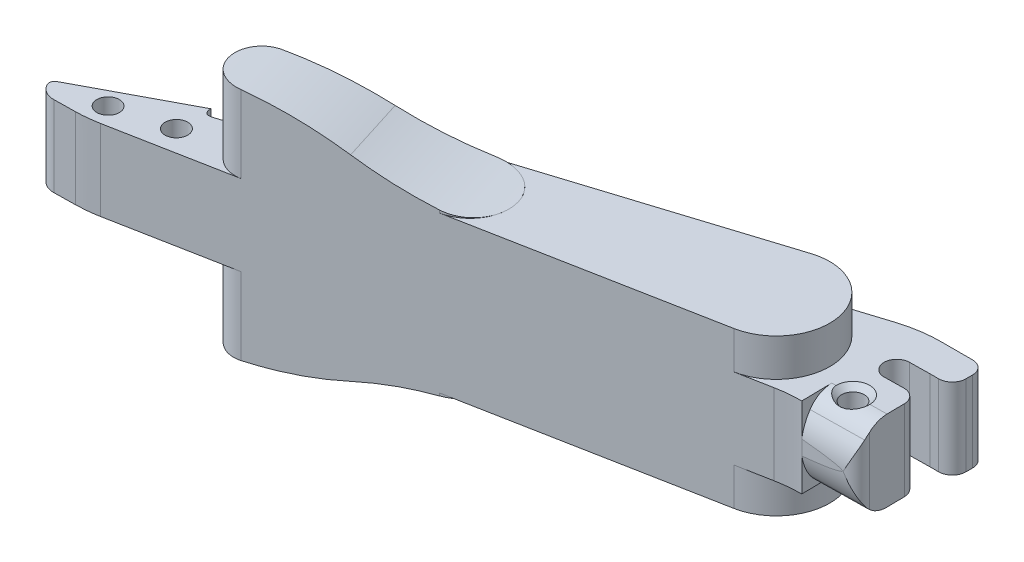
from build123d import *
from build123d.topology import SkipClean

# Parameters (mm, degrees)
SKETCH1_R                = 1.0668
BOSS_EXTRUDE1_DEPTH      = 7.62
FILLET1_R                = 0.635
FILLET2_R                = 0.254
FILLET3_R                = 12.7
FILLET4_R                = 6.35
FILLET5_R                = 6.35
FILLET6_R                = 12.7
FILLET7_R                = 1.27
CHAMFER1_SIZE            = 0.508
BOSS_EXTRUDE2_DEPTH      = 7.62
SKETCH3_R                = 1.0668
CUT_EXTRUDE1_DEPTH       = 54.69653448
BOSS_EXTRUDE3_DEPTH      = 7.62
CUT_EXTRUDE2_DEPTH       = 54.69653448
CUT_EXTRUDE3_DEPTH       = 54.696534623
CUT_EXTRUDE3_DEPTH_BACK  = 54.696534623
CUT_EXTRUDE4_DEPTH       = 54.696534623
CUT_EXTRUDE5_DEPTH       = 54.696534623
CUT_EXTRUDE7_DEPTH       = 5.149124
CUT_EXTRUDE8_DEPTH       = 54.696534623
SKETCH13_R               = 1.0668
BOSS_EXTRUDE4_DEPTH      = 7.62
SKETCH14_R               = 1.0668
CUT_EXTRUDE10_DEPTH      = 54.696534623
CUT_EXTRUDE11_DEPTH      = 54.696534623
BOSS_EXTRUDE5_DEPTH      = 7.62
BOSS_EXTRUDE6_DEPTH      = 3.556
BOSS_EXTRUDE7_START      = 3.556
BOSS_EXTRUDE7_DEPTH      = 3.556
BOSS_EXTRUDE8_START      = -14.732
BOSS_EXTRUDE8_DEPTH      = 14.732
BOSS_EXTRUDE9_START      = 3.81
BOSS_EXTRUDE9_DEPTH      = 3.81
BOSS_EXTRUDE10_DEPTH     = 3.81
CUT_EXTRUDE14_DEPTH      = 53.444849107
CUT_EXTRUDE14_DEPTH_BACK = 53.444849107
CUT_EXTRUDE15_DEPTH      = 53.612958424
CUT_EXTRUDE15_DEPTH_BACK = 53.612958424


with BuildPart() as part:
    # Sketch1 → Boss-Extrude1 (new body)
    with BuildSketch(Plane(origin=(0, 0, 0), x_dir=(1, 0, 0), z_dir=(0, 1, 0))):
        with BuildLine():
            ThreePointArc((-2.312651627, -3.977825944), (-2.983997225, -5.519250699), (-1.53747622, -6.376147525))
            Line((-1.53747622, -6.376147525), (13.957313837, -3.419054878))
            Line((13.957313837, -3.419054878), (20.308092604, -3.419054878))
            Line((20.308092604, -3.419054878), (20.397600553, -9.134054878))
            Line((20.397600553, -9.134054878), (14.046821786, -9.134054878))
            Line((14.046821786, -9.134054878), (-41.672552026, -19.767780795))
            Line((-41.672552026, -19.767780795), (-49.292552026, -19.887124727))
            Line((-49.292552026, -19.887124727), (13.758431673, 9.279387778))
            Line((13.758431673, 9.279387778), (20.109210441, 9.279387778))
            Line((20.109210441, 9.279387778), (20.197160951, 3.663828859))
            Line((20.197160951, 3.663828859), (13.847939623, 3.564387778))
            Line((13.847939623, 3.564387778), (-2.312651627, -3.977825944))
        make_face()
        with Locations(Location((16.977796312, 6.471608319, 0), (0, 0, 90))):
            Circle(SKETCH1_R, mode=Mode.SUBTRACT)
        with Locations(Location((17.176678475, -6.226834337, 0), (0, 0, 90))):
            Circle(SKETCH1_R, mode=Mode.SUBTRACT)
        with BuildLine():
            Line((-24.483085862, -12.608506291), (-6.807562993, -4.432054021))
            ThreePointArc((-6.807562993, -4.432054021), (-6.543189182, -6.882524401), (-5.156537158, -8.920144277))
            Line((-5.156537158, -8.920144277), (-24.483085862, -12.608506291))
        make_face(mode=Mode.SUBTRACT)
    extrude(amount=BOSS_EXTRUDE1_DEPTH)

    # Fillet1
    fillet1_edges = [part.edges().sort_by_distance(p)[0] for p in [
        (-5.156537158, 3.81, 8.920144277),
        (-6.807562993, 3.81, 4.432054021),
    ]]
    fillet(fillet1_edges, radius=FILLET1_R)

    # Fillet2
    fillet2_edges = [part.edges().sort_by_distance(p)[0] for p in [
        (-24.483085862, 3.81, 12.608506291),
    ]]
    fillet(fillet2_edges, radius=FILLET2_R)

    # Fillet3
    fillet3_edges = [part.edges().sort_by_distance(p)[0] for p in [
        (13.957313837, 3.81, 3.419054878),
    ]]
    fillet(fillet3_edges, radius=FILLET3_R)

    # Fillet4
    fillet4_edges = [part.edges().sort_by_distance(p)[0] for p in [
        (13.758431673, 3.81, -9.279387778),
    ]]
    fillet(fillet4_edges, radius=FILLET4_R)

    # Fillet5
    fillet5_edges = [part.edges().sort_by_distance(p)[0] for p in [
        (13.847939623, 3.81, -3.564387778),
    ]]
    fillet(fillet5_edges, radius=FILLET5_R)

    # Fillet6
    fillet6_edges = [part.edges().sort_by_distance(p)[0] for p in [
        (14.046821786, 3.81, 9.134054878),
    ]]
    fillet(fillet6_edges, radius=FILLET6_R)

    # Fillet7
    fillet7_edges = [part.edges().sort_by_distance(p)[0] for p in [
        (20.308092604, 3.81, 3.419054878),
        (20.397600553, 3.81, 9.134054878),
        (20.109210441, 3.81, -9.279387778),
        (20.197160951, 3.81, -3.663828859),
    ]]
    fillet(fillet7_edges, radius=FILLET7_R)

    # Chamfer1
    chamfer1_edges = [part.edges().sort_by_distance(p)[0] for p in [
        (17.176678475, 7.62, 7.293634337),
        (17.176678475, 0, 7.293634337),
        (16.977796312, 0, -5.404808319),
        (16.977796312, 7.62, -5.404808319),
    ]]
    chamfer(chamfer1_edges, length=CHAMFER1_SIZE)

    # Sketch2 → Boss-Extrude2 (add)
    with BuildSketch(Plane(origin=(0, 7.62, 0), x_dir=(1, 0, 0), z_dir=(0, 1, 0))):
        Polygon((-49.292552026, -19.887124727), (-36.592552026, -12.132680481), (-36.592552026, -14.012280481), align=None)
    extrude(amount=-BOSS_EXTRUDE2_DEPTH)

    # Sketch3 → Cut-Extrude1 (cut, through all)
    with BuildSketch(Plane(origin=(0, 7.62, 0), x_dir=(1, 0, 0), z_dir=(0, 1, 0))):
        with Locations(Location((-36.592552026, -16.405286069, 0), (0, 0, 270))):
            Circle(SKETCH3_R)
        with Locations(Location((-41.672552026, -17.501119487, 0), (0, 0, 270))):
            Circle(SKETCH3_R)
    extrude(amount=-CUT_EXTRUDE1_DEPTH, mode=Mode.SUBTRACT)

    # Sketch4 → Boss-Extrude3 (add)
    with BuildSketch(Plane(origin=(0, 7.62, 0), x_dir=(1, 0, 0), z_dir=(0, 1, 0))):
        Polygon((-36.592552026, -14.012280481), (15.068829325, 2.295945122), (20.218584655, 2.295945122), (20.327671772, -4.669166662), (15.164053413, -3.784025035), (-17.814325189, -14.012280481), align=None)
    extrude(amount=-BOSS_EXTRUDE3_DEPTH)

    # Sketch5 → Cut-Extrude2 (cut, through all)
    with BuildSketch(Plane(origin=(0, 7.62, 0), x_dir=(1, 0, 0), z_dir=(0, 1, 0))):
        with BuildLine():
            Line((-36.592552026, -14.012280481), (2.897388899, -1.546278822))
            Line((2.897388899, -1.546278822), (12.618479777, 2.990593863))
            ThreePointArc((12.618479777, 2.990593863), (13.880078999, 3.424709468), (15.204538139, 3.585634734))
            Line((15.204538139, 3.585634734), (18.927316685, 3.643940643))
            ThreePointArc((18.927316685, 3.643940643), (19.819407053, 4.02993251), (20.177272734, 4.933673125))
            Line((20.177272734, 4.933673125), (20.128789608, 8.029275994))
            ThreePointArc((20.128789608, 8.029275994), (19.749911662, 8.914417621), (18.858945343, 9.279387778))
            Line((18.858945343, 9.279387778), (15.155999337, 9.279387778))
            ThreePointArc((15.155999337, 9.279387778), (13.791098221, 9.130963783), (12.490003113, 8.692630279))
            Line((12.490003113, 8.692630279), (-36.592552026, -14.012280481))
        make_face()
    extrude(amount=-CUT_EXTRUDE2_DEPTH, mode=Mode.SUBTRACT)

    # Fillet8
    # a fillet whose section is not a circle: 12.7 mm, written as the material it takes off along each edge
    with BuildSketch(Plane(origin=(15.068829325, 12.512358386, -2.295945122), x_dir=(1, 0, 0), z_dir=(0, -1, 0))) as fillet8_piece_1:
        with BuildLine():
            Bezier((1.956943354, 0), (0, 0), (-1.866168396, 0.589103396), weights=[1, 1, 1])
            Line((-1.866168396, 0.589103396), (0, 0))
            Line((0, 0), (1.956943354, 0))
        make_face()
    extrude(amount=17.404716772, mode=Mode.SUBTRACT)

    # Sketch6 → Cut-Extrude3 (cut, two sides: drawn at the far end of the back side and taken through both)
    with BuildSketch(Plane(origin=(0, 7.62, 0), x_dir=(1, 0, 0), z_dir=(0, 1, 0)).offset(-CUT_EXTRUDE3_DEPTH_BACK)):
        with BuildLine():
            Line((20.218584655, 2.295945122), (19.018407407, 2.295945122))
            ThreePointArc((19.018407407, 2.295945122), (19.873375685, 1.917898502), (20.237987132, 1.05711485))
            Line((20.237987132, 1.05711485), (20.218584655, 2.295945122))
        make_face()
    extrude(amount=CUT_EXTRUDE3_DEPTH + CUT_EXTRUDE3_DEPTH_BACK, mode=Mode.SUBTRACT)

    # Sketch7 → Cut-Extrude4 (cut, through all)
    with BuildSketch(Plane(origin=(0, 7.62, 0), x_dir=(1, 0, 0), z_dir=(0, 1, 0))):
        with BuildLine():
            Line((20.24793246, 0.42211485), (20.325179868, -4.510060931))
            ThreePointArc((20.325179868, -4.510060931), (19.932019888, -3.61107774), (19.015564048, -3.260572047))
            Line((19.015564048, -3.260572047), (17.110564048, -3.29040803))
            ThreePointArc((17.110564048, -3.29040803), (15.977629833, -2.062137634), (17.162746342, -0.884136377))
            Line((17.162746342, -0.884136377), (19.067746342, -0.854300394))
            ThreePointArc((19.067746342, -0.854300394), (19.910456304, -0.449664851), (20.24793246, 0.42211485))
        make_face()
    extrude(amount=-CUT_EXTRUDE4_DEPTH, mode=Mode.SUBTRACT)

    # Fillet9
    # a fillet whose section is not a circle: 0.635 mm, written as the material it adds along each edge
    with BuildSketch(Plane(origin=(-36.592552026, 7.62, 14.012280481), x_dir=(0.9536139058078862, 0, -0.30103242126028223), z_dir=(0, -1, 0))) as fillet9_piece_1:
        with BuildLine():
            Bezier((0.8663418, 0), (0, 0), (0.26079697, -0.826155588), weights=[1, 1, 1])
            Line((0.26079697, -0.826155588), (0, 0))
            Line((0, 0), (0.8663418, 0))
        make_face()
    extrude(amount=7.62)

    # Fillet10
    # a fillet whose section is not a circle: 12.7 mm, written as the material it takes off along each edge
    with BuildSketch(Plane(origin=(-41.672552026, -2.751902811, 19.767780795), x_dir=(-0.9998773744802418, 0, 0.01566001285115453), z_dir=(0, 1, 0))) as fillet10_piece_1:
        with BuildLine():
            Bezier((1.100761124, 0), (0, 0), (-1.084345727, -0.189392179), weights=[1, 1, 1])
            Line((-1.084345727, -0.189392179), (0, 0))
            Line((0, 0), (1.100761124, 0))
        make_face()
    extrude(amount=13.123805621, mode=Mode.SUBTRACT)

    # Sketch9 → Cut-Extrude5 (cut, through all)
    with BuildSketch(Plane(origin=(0, 7.62, 0), x_dir=(1, 0, 0), z_dir=(0, 1, 0))):
        with BuildLine():
            Line((-29.571777095, -13.977835129), (-15.244312484, -9.455007456))
            ThreePointArc((-15.244312484, -9.455007456), (-13.316095328, -10.530846836), (-14.50301541, -12.392747073))
            Line((-14.50301541, -12.392747073), (-29.261015781, -15.209227595))
            ThreePointArc((-29.261015781, -15.209227595), (-29.997046992, -14.740067689), (-29.571777095, -13.977835129))
        make_face()
        with BuildLine():
            Line((-5.388668297, -10.167027605), (9.807798425, -7.266868272))
            ThreePointArc((9.807798425, -7.266868272), (11.761477374, -4.202167157), (8.587618135, -2.431327837))
            Line((8.587618135, -2.431327837), (-6.165571582, -7.08854644))
            ThreePointArc((-6.165571582, -7.08854644), (-7.228746323, -8.99412784), (-5.388668297, -10.167027605))
        make_face()
    extrude(amount=-CUT_EXTRUDE5_DEPTH, mode=Mode.SUBTRACT)

    # Sketch10 → Cut-Extrude7 (cut)
    with BuildSketch(Plane(origin=(20.249576451, 0, -0.317147518), x_dir=(-0.01566001285114326, 0, -0.999877374480242), z_dir=(0.999877374480242, 0, -0.01566001285114326))):
        with BuildLine():
            Line((-9.432159353, 7.62), (-6.494979907, 7.62))
            ThreePointArc((-6.494979907, 7.62), (-7.6748352, 7.326256661), (-8.5792363, 6.513605253))
            ThreePointArc((-8.5792363, 6.513605253), (-9.202551479, 5.22389865), (-9.43223722, 3.81))
            ThreePointArc((-9.43223722, 3.81), (-9.202551479, 2.39610135), (-8.5792363, 1.106394747))
            ThreePointArc((-8.5792363, 1.106394747), (-7.6748352, 0.293743339), (-6.494979907, 0))
            Line((-6.494979907, 0), (-11.972159353, 0))
            Line((-11.972159353, 0), (-11.972159353, 7.62))
            Line((-11.972159353, 7.62), (-9.432159353, 7.62))
        make_face()
    extrude(amount=-CUT_EXTRUDE7_DEPTH, mode=Mode.SUBTRACT)

    # Sketch11 → Cut-Extrude8 (cut, through all)
    with BuildSketch(Plane(origin=(0, 7.62, 0), x_dir=(1, 0, 0), z_dir=(0, 1, 0))):
        Polygon((-36.592552026, -13.145938681), (-36.592552026, -12.132680481), (-49.292552026, -19.887124727), align=None)
    extrude(amount=-CUT_EXTRUDE8_DEPTH, mode=Mode.SUBTRACT)

    # Sketch13 → Boss-Extrude4 (add)
    with BuildSketch(Plane(origin=(0, 7.62, 0), x_dir=(1, 0, 0), z_dir=(0, 1, 0))):
        with Locations((-41.672552026, -17.501119487)):
            Circle(SKETCH13_R)
    extrude(amount=-BOSS_EXTRUDE4_DEPTH)

    # Sketch14 → Cut-Extrude10 (cut, through all)
    with BuildSketch(Plane(origin=(0, 7.62, 0), x_dir=(1, 0, 0), z_dir=(0, 1, 0))):
        with Locations(Location((-41.674974434, -17.781457961, 0), (0, 0, 270))):
            Circle(SKETCH14_R)
    extrude(amount=-CUT_EXTRUDE10_DEPTH, mode=Mode.SUBTRACT)

    # Sketch17 → Cut-Extrude11 (cut, through all)
    with BuildSketch(Plane(origin=(0, 7.62, 0), x_dir=(1, 0, 0), z_dir=(0, 1, 0))):
        with BuildLine():
            Line((-49.409275542, -19.888952843), (-44.771803837, -19.81632107))
            ThreePointArc((-44.771803837, -19.81632107), (-46.481112693, -18.436952916), (-45.432973627, -16.506720348))
            Line((-45.432973627, -16.506720348), (-54.118552026, -19.962709218))
            Line((-54.118552026, -19.962709218), (-49.409275542, -19.888952843))
        make_face()
    extrude(amount=-CUT_EXTRUDE11_DEPTH, mode=Mode.SUBTRACT)

    # Fillet11
    # a fillet whose section is not a circle: 0.635 mm, written as the material it takes off along each edge
    with BuildSketch(Plane(origin=(-46.488316562, -1.753141666, 18.398630792), x_dir=(0.8832795965345345, 0, -0.4688466213441132), z_dir=(0, 1, 0))) as fillet11_piece_1:
        with BuildLine():
            Bezier((0.556554646, 0), (-0.144005597, 0), (-0.075392454, -0.697192147), weights=[1, 1, 1])
            ThreePointArc((-0.075392454, -0.697192147), (-0.073696784, -0.344703072), (0, 0))
            Line((0, 0), (0.556554646, 0))
        make_face()
    extrude(amount=11.126283331, mode=Mode.SUBTRACT)

    # Sketch21 → Boss-Extrude5 (add)
    with BuildSketch(Plane(origin=(0, 7.62, 0), x_dir=(1, 0, 0), z_dir=(0, 1, 0))):
        with BuildLine():
            Line((19.018407407, 2.295945122), (20.914672066, 2.295945122))
            ThreePointArc((20.914672066, 2.295945122), (21.776336171, 1.942978151), (22.14275353, 1.086947175))
            Line((22.14275353, 1.086947175), (22.152698858, 0.451947175))
            ThreePointArc((22.152698858, 0.451947175), (21.783257579, -0.470459517), (20.866749453, -0.854300394))
            Line((20.866749453, -0.854300394), (19.067746342, -0.854300394))
            Line((19.067746342, -0.854300394), (19.018407407, 2.295945122))
        make_face()
    extrude(amount=-BOSS_EXTRUDE5_DEPTH)

    # Sketch22 → Boss-Extrude6 (add)
    with BuildSketch(Plane.XZ):
        with BuildLine():
            Line((9.661769091, 9.970917271), (-29.465809554, 17.438193348))
            ThreePointArc((-29.465809554, 17.438193348), (-32.607832358, 15.435223538), (-30.792315179, 12.181288576))
            Line((-30.792315179, 12.181288576), (7.193702545, 0.190038428))
            ThreePointArc((7.193702545, 0.190038428), (13.61348811, 3.771926547), (9.661769091, 9.970917271))
        make_face()
        with BuildLine():
            Line((9.807798425, 7.266868272), (-5.388668297, 10.167027605))
            ThreePointArc((-5.388668297, 10.167027605), (-7.228746323, 8.99412784), (-6.165571582, 7.08854644))
            Line((-6.165571582, 7.08854644), (8.587618135, 2.431327837))
            ThreePointArc((8.587618135, 2.431327837), (11.761477374, 4.202167157), (9.807798425, 7.266868272))
        make_face(mode=Mode.SUBTRACT)
        with BuildLine():
            Line((-14.50301541, 12.392747073), (-29.261015781, 15.209227595))
            ThreePointArc((-29.261015781, 15.209227595), (-29.997046992, 14.740067689), (-29.571777095, 13.977835129))
            Line((-29.571777095, 13.977835129), (-15.244312484, 9.455007456))
            ThreePointArc((-15.244312484, 9.455007456), (-13.316095328, 10.530846836), (-14.50301541, 12.392747073))
        make_face(mode=Mode.SUBTRACT)
    extrude(amount=BOSS_EXTRUDE6_DEPTH)

    # Sketch23 → Boss-Extrude7 (add)
    with SkipClean():  # the faces are left unmerged after this step: merging them gives an invalid solid
        with BuildSketch(Plane(origin=(0, 7.62, 0), x_dir=(1, 0, 0), z_dir=(0, 1, 0)).offset(BOSS_EXTRUDE7_START)):
            with BuildLine():
                Line((-29.465809554, -17.438193348), (9.661769091, -9.970917271))
                ThreePointArc((9.661769091, -9.970917271), (13.61348811, -3.771926547), (7.193702545, -0.190038428))
                Line((7.193702545, -0.190038428), (-30.792315179, -12.181288576))
                ThreePointArc((-30.792315179, -12.181288576), (-32.607832358, -15.435223538), (-29.465809554, -17.438193348))
            make_face()
            with BuildLine():
                Line((-15.244312484, -9.455007456), (-29.571777095, -13.977835129))
                ThreePointArc((-29.571777095, -13.977835129), (-29.997046992, -14.740067689), (-29.261015781, -15.209227595))
                Line((-29.261015781, -15.209227595), (-14.50301541, -12.392747073))
                ThreePointArc((-14.50301541, -12.392747073), (-13.316095328, -10.530846836), (-15.244312484, -9.455007456))
            make_face(mode=Mode.SUBTRACT)
            with BuildLine():
                Line((8.587618135, -2.431327837), (-6.165571582, -7.08854644))
                ThreePointArc((-6.165571582, -7.08854644), (-7.228746323, -8.99412784), (-5.388668297, -10.167027605))
                Line((-5.388668297, -10.167027605), (9.807798425, -7.266868272))
                ThreePointArc((9.807798425, -7.266868272), (11.761477374, -4.202167157), (8.587618135, -2.431327837))
            make_face(mode=Mode.SUBTRACT)
        extrude(amount=-BOSS_EXTRUDE7_DEPTH)

    # Sketch24 → Boss-Extrude8 (add)
    with BuildSketch(Plane.XZ.offset(3.556).offset(BOSS_EXTRUDE8_START)):
        with BuildLine():
            Line((-14.50301541, 12.392747073), (-29.261015781, 15.209227595))
            ThreePointArc((-29.261015781, 15.209227595), (-29.997046992, 14.740067689), (-29.571777095, 13.977835129))
            Line((-29.571777095, 13.977835129), (-15.244312484, 9.455007456))
            ThreePointArc((-15.244312484, 9.455007456), (-13.316095328, 10.530846836), (-14.50301541, 12.392747073))
        make_face()
        with BuildLine():
            Line((-6.165571582, 7.08854644), (8.587618135, 2.431327837))
            ThreePointArc((8.587618135, 2.431327837), (11.761477374, 4.202167157), (9.807798425, 7.266868272))
            Line((9.807798425, 7.266868272), (-5.388668297, 10.167027605))
            ThreePointArc((-5.388668297, 10.167027605), (-7.228746323, 8.99412784), (-6.165571582, 7.08854644))
        make_face()
    extrude(amount=BOSS_EXTRUDE8_DEPTH)

    # Sketch35 → Boss-Extrude9 (add)
    with BuildSketch(Plane(origin=(0, 11.176, 0), x_dir=(1, 0, 0), z_dir=(0, 1, 0)).offset(BOSS_EXTRUDE9_START)):
        with BuildLine():
            Line((-15.496741442, -7.352852698), (-30.792315179, -12.181288576))
            ThreePointArc((-30.792315179, -12.181288576), (-32.607832358, -15.435223538), (-29.465809554, -17.438193348))
            Line((-29.465809554, -17.438193348), (-13.710571175, -14.431395618))
            ThreePointArc((-13.710571175, -14.431395618), (-10.850663274, -9.945109405), (-15.496741442, -7.352852698))
        make_face()
    extrude(amount=-BOSS_EXTRUDE9_DEPTH)

    # Sketch36 → Boss-Extrude10 (add)
    with BuildSketch(Plane.XZ.offset(3.556)):
        with BuildLine():
            Line((-13.710571175, 14.431395618), (-29.465809554, 17.438193348))
            ThreePointArc((-29.465809554, 17.438193348), (-32.607832358, 15.435223538), (-30.792315179, 12.181288576))
            Line((-30.792315179, 12.181288576), (-15.496741442, 7.352852698))
            ThreePointArc((-15.496741442, 7.352852698), (-10.850663274, 9.945109405), (-13.710571175, 14.431395618))
        make_face()
    extrude(amount=BOSS_EXTRUDE10_DEPTH)

    # Sketch37 → Cut-Extrude14 (cut, two sides: drawn at the far end of the back side and taken through both)
    with BuildSketch(Plane(origin=(0.706451141, 0, 2.237903906), x_dir=(-0.9536139058078862, 0, 0.30103242126028246), z_dir=(-0.3010324212602824, 0, -0.9536139058078861)).offset(-CUT_EXTRUDE14_DEPTH_BACK)):
        with BuildLine():
            Line((35.746446092, -7.366), (13.334867602, -7.366))
            Line((13.334867602, -7.366), (13.334867602, -3.556))
            ThreePointArc((13.334867602, -3.556), (19.018148732, -4.035642121), (24.540656847, -5.461))
            ThreePointArc((24.540656847, -5.461), (30.063164962, -6.886357879), (35.746446092, -7.366))
        make_face()
        with BuildLine():
            Line((13.334867602, 11.176), (13.334867602, 14.986))
            Line((13.334867602, 14.986), (35.746446092, 14.986))
            ThreePointArc((35.746446092, 14.986), (30.063164962, 14.506357879), (24.540656847, 13.081))
            ThreePointArc((24.540656847, 13.081), (19.018148732, 11.655642121), (13.334867602, 11.176))
        make_face()
    extrude(amount=CUT_EXTRUDE14_DEPTH + CUT_EXTRUDE14_DEPTH_BACK, mode=Mode.SUBTRACT)

    # Sketch38 → Cut-Extrude15 (cut, two sides: drawn at the far end of the back side and taken through both)
    with BuildSketch(Plane(origin=(0, 7.62, 0), x_dir=(1, 0, 0), z_dir=(0, 1, 0)).offset(-CUT_EXTRUDE15_DEPTH_BACK)):
        with BuildLine():
            Line((21.195490158, 0.418197283), (21.195490158, 1.05327516))
            ThreePointArc((21.195490158, 1.05327516), (20.840923823, 1.931084622), (19.967342943, 2.295945122))
            Line((19.967342943, 2.295945122), (20.914672066, 2.295945122))
            ThreePointArc((20.914672066, 2.295945122), (21.776336171, 1.942978151), (22.14275353, 1.086947175))
            Line((22.14275353, 1.086947175), (22.152698858, 0.451947175))
            ThreePointArc((22.152698858, 0.451947175), (21.783257579, -0.470459517), (20.866749453, -0.854300394))
            Line((20.866749453, -0.854300394), (19.909455052, -0.854300394))
            ThreePointArc((19.909455052, -0.854300394), (20.814045655, -0.482407342), (21.195490158, 0.418197283))
        make_face()
    extrude(amount=CUT_EXTRUDE15_DEPTH + CUT_EXTRUDE15_DEPTH_BACK, mode=Mode.SUBTRACT)


solid = part.part
